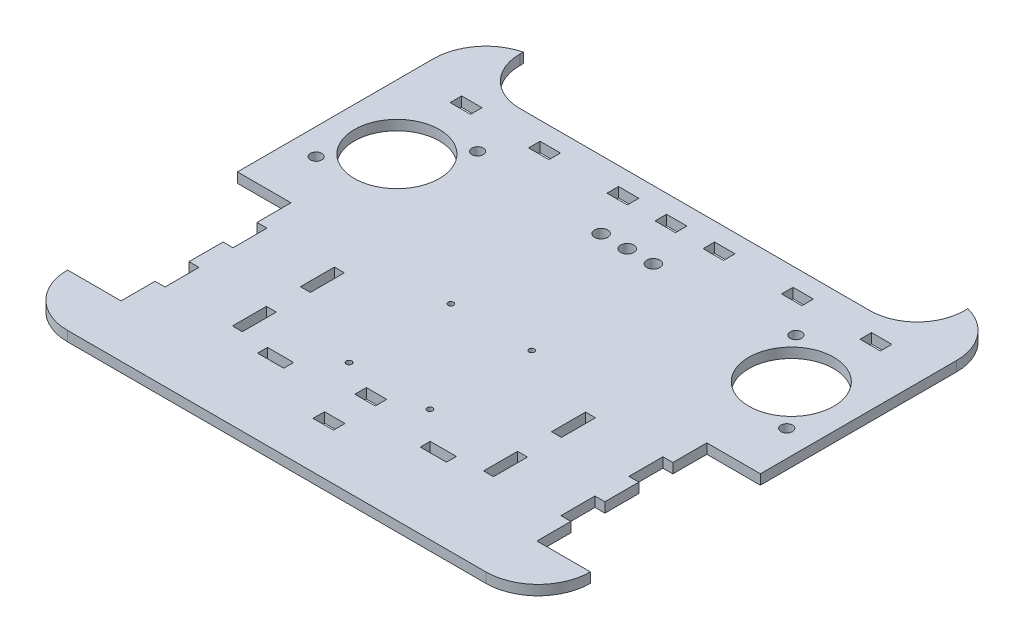
from build123d import *

# Parameters (mm, degrees)
SKETCH1_W           = 254
SKETCH1_H           = 228.6
BOSS_EXTRUDE1_DEPTH = 4.826
SKETCH2_W           = 26.00000007
SKETCH2_H           = 82.55
CUT_EXTRUDE1_DEPTH  = 4.826
CUT_EXTRUDE3_DEPTH  = 4.826
SKETCH7_W           = 215.9
SKETCH7_H           = 25.4
CUT_EXTRUDE5_DEPTH  = 4.826
FILLET9_R           = 22.86
FILLET10_R          = 22.86
CUT_EXTRUDE6_DEPTH  = 4.826
SKETCH10_W          = 4.826
SKETCH10_H          = 16.51
CUT_EXTRUDE8_DEPTH  = 171.929167423
SKETCH12_W          = 4.826
SKETCH12_H          = 16.51
CUT_EXTRUDE9_DEPTH  = 171.929167423
SKETCH13_W          = 4.826
SKETCH13_H          = 16.51
CUT_EXTRUDE10_DEPTH = 171.929167423
SKETCH15_R          = 1.3462
CUT_EXTRUDE11_DEPTH = 171.929167423
SKETCH16_R          = 2.778125
SKETCH16_R_2        = 20.6375
CUT_EXTRUDE12_DEPTH = 171.929167423
SKETCH17_W          = 9.906
SKETCH17_H          = 5.588
CUT_EXTRUDE13_DEPTH = 171.929167423
SKETCH18_W          = 9.906
SKETCH18_H          = 5.588
CUT_EXTRUDE14_DEPTH = 171.929167423
SKETCH19_R          = 3.175
CUT_EXTRUDE15_DEPTH = 171.929167423
SKETCH22_W          = 12.7
SKETCH22_H          = 4.826
CUT_EXTRUDE18_DEPTH = 171.929167423


with BuildPart() as part:
    # Sketch1 → Boss-Extrude1 (new body)
    with BuildSketch(Plane(origin=(0, 0, 0), x_dir=(1, 0, 0), z_dir=(0, 1, 0))):
        Rectangle(SKETCH1_W, SKETCH1_H)
    extrude(amount=BOSS_EXTRUDE1_DEPTH)

    # Sketch2 → Cut-Extrude1 (cut)
    with BuildSketch(Plane(origin=(0, 4.826, 0), x_dir=(1, 0, 0), z_dir=(0, 1, 0))):
        with Locations((-113.999999965, -47.625)):
            Rectangle(SKETCH2_W, SKETCH2_H)
        with Locations((113.999999965, -47.625)):
            Rectangle(SKETCH2_W, SKETCH2_H)
    extrude(amount=-CUT_EXTRUDE1_DEPTH, mode=Mode.SUBTRACT)

    # Sketch4 → Cut-Extrude3 (cut)
    with BuildSketch(Plane(origin=(0, 4.826, 0), x_dir=(1, 0, 0), z_dir=(0, 1, 0))):
        with BuildLine():
            Line((-127, 88.9), (-127, 114.3))
            Line((-127, 114.3), (-101.6, 114.3))
            ThreePointArc((-101.6, 114.3), (-119.560512242, 106.860512242), (-127, 88.9))
        make_face()
        with BuildLine():
            Line((127, 88.9), (127, 114.3))
            Line((127, 114.3), (101.6, 114.3))
            ThreePointArc((101.6, 114.3), (119.560512242, 106.860512242), (127, 88.9))
        make_face()
    extrude(amount=-CUT_EXTRUDE3_DEPTH, mode=Mode.SUBTRACT)

    # Sketch7 → Cut-Extrude5 (cut)
    with BuildSketch(Plane(origin=(0, 4.826, 0), x_dir=(1, 0, 0), z_dir=(0, 1, 0))):
        with Locations((0, 101.6)):
            Rectangle(SKETCH7_W, SKETCH7_H)
    extrude(amount=-CUT_EXTRUDE5_DEPTH, mode=Mode.SUBTRACT)

    # Fillet9
    fillet9_edges = [part.edges().sort_by_distance(p)[0] for p in [
        (-107.95, 2.413, -88.9),
    ]]
    fillet(fillet9_edges, radius=FILLET9_R)

    # Fillet10
    fillet10_edges = [part.edges().sort_by_distance(p)[0] for p in [
        (107.95, 2.413, -88.9),
    ]]
    fillet(fillet10_edges, radius=FILLET10_R)

    # Sketch8 → Cut-Extrude6 (cut)
    with BuildSketch(Plane(origin=(0, 4.826, 0), x_dir=(1, 0, 0), z_dir=(0, 1, 0))):
        with BuildLine():
            Line((-127, -88.9), (-127, -114.3))
            Line((-127, -114.3), (-101.6, -114.3))
            ThreePointArc((-101.6, -114.3), (-119.560512242, -106.860512242), (-127, -88.9))
        make_face()
        with BuildLine():
            Line((127, -114.3), (101.6, -114.3))
            ThreePointArc((101.6, -114.3), (119.560512242, -106.860512242), (127, -88.9))
            Line((127, -88.9), (127, -114.3))
        make_face()
    extrude(amount=-CUT_EXTRUDE6_DEPTH, mode=Mode.SUBTRACT)

    # Sketch10 → Cut-Extrude8 (cut, through all)
    with BuildSketch(Plane(origin=(0, 4.826, 0), x_dir=(1, 0, 0), z_dir=(0, 1, 0))):
        with Locations((-98.58699993, -64.135)):
            Rectangle(SKETCH10_W, SKETCH10_H)
        with Locations((-98.58699993, -31.115)):
            Rectangle(SKETCH10_W, SKETCH10_H)
        with Locations((98.58699993, -31.115)):
            Rectangle(SKETCH10_W, SKETCH10_H)
        with Locations((98.58699993, -64.135)):
            Rectangle(SKETCH10_W, SKETCH10_H)
    extrude(amount=-CUT_EXTRUDE8_DEPTH, mode=Mode.SUBTRACT)

    # Sketch12 → Cut-Extrude9 (cut, through all)
    with BuildSketch(Plane.XZ):
        with Locations((-60.99499993, 64.135)):
            Rectangle(SKETCH12_W, SKETCH12_H)
        with Locations((-60.99499993, 31.115)):
            Rectangle(SKETCH12_W, SKETCH12_H)
    extrude(amount=-CUT_EXTRUDE9_DEPTH, mode=Mode.SUBTRACT)

    # Sketch13 → Cut-Extrude10 (cut, through all)
    with BuildSketch(Plane(origin=(0, 4.826, 0), x_dir=(1, 0, 0), z_dir=(0, 1, 0))):
        with Locations((60.99499993, -64.135)):
            Rectangle(SKETCH13_W, SKETCH13_H)
        with Locations((60.99499993, -31.115)):
            Rectangle(SKETCH13_W, SKETCH13_H)
    extrude(amount=-CUT_EXTRUDE10_DEPTH, mode=Mode.SUBTRACT)

    # Sketch15 → Cut-Extrude11 (cut, through all)
    with BuildSketch(Plane(origin=(0, 4.826, 0), x_dir=(1, 0, 0), z_dir=(0, 1, 0))):
        with Locations((19.5961, -10.030838906)):
            Circle(SKETCH15_R)
        with Locations((-19.6723, -10.030838906)):
            Circle(SKETCH15_R)
        with Locations((-19.6723, -59.463561094)):
            Circle(SKETCH15_R)
        with Locations((19.5961, -59.463561094)):
            Circle(SKETCH15_R)
    extrude(amount=-CUT_EXTRUDE11_DEPTH, mode=Mode.SUBTRACT)

    # Sketch16 → Cut-Extrude12 (cut, through all)
    with BuildSketch(Plane(origin=(0, 4.826, 0), x_dir=(1, 0, 0), z_dir=(0, 1, 0))):
        with Locations((77.293854564, 60.610218612)):
            Circle(SKETCH16_R)
        with Locations((114.3, 19.164632523)):
            Circle(SKETCH16_R)
        with Locations((95.796927282, 39.887425568)):
            Circle(SKETCH16_R_2)
        with Locations((-95.796927282, 39.887425568)):
            Circle(SKETCH16_R_2)
        with Locations((-77.293854564, 60.610218612)):
            Circle(SKETCH16_R)
        with Locations((-114.3, 19.164632523)):
            Circle(SKETCH16_R)
    extrude(amount=-CUT_EXTRUDE12_DEPTH, mode=Mode.SUBTRACT)

    # Sketch17 → Cut-Extrude13 (cut, through all)
    with BuildSketch(Plane(origin=(0, 4.826, 0), x_dir=(1, 0, 0), z_dir=(0, 1, 0))):
        with Locations((-61.445869789, 77.244822677)):
            Rectangle(SKETCH17_W, SKETCH17_H)
        with Locations((-99.545869789, 77.244822677)):
            Rectangle(SKETCH17_W, SKETCH17_H)
        with Locations((-23.345869789, 77.244822677)):
            Rectangle(SKETCH17_W, SKETCH17_H)
        with Locations((0, 77.244822677)):
            Rectangle(SKETCH17_W, SKETCH17_H)
        with Locations((23.345869789, 77.244822677)):
            Rectangle(SKETCH17_W, SKETCH17_H)
        with Locations((61.445869789, 77.244822677)):
            Rectangle(SKETCH17_W, SKETCH17_H)
        with Locations((99.545869789, 77.244822677)):
            Rectangle(SKETCH17_W, SKETCH17_H)
    extrude(amount=-CUT_EXTRUDE13_DEPTH, mode=Mode.SUBTRACT)

    # Sketch18 → Cut-Extrude14 (cut, through all)
    with BuildSketch(Plane(origin=(0, 4.826, 0), x_dir=(1, 0, 0), z_dir=(0, 1, 0))):
        with Locations((0, -88.9)):
            Rectangle(SKETCH18_W, SKETCH18_H)
        with Locations((0, -68.58)):
            Rectangle(SKETCH18_W, SKETCH18_H)
    extrude(amount=-CUT_EXTRUDE14_DEPTH, mode=Mode.SUBTRACT)

    # Sketch19 → Cut-Extrude15 (cut, through all)
    with BuildSketch(Plane(origin=(0, 4.826, 0), x_dir=(1, 0, 0), z_dir=(0, 1, 0))):
        with Locations((0, 55.982011538)):
            Circle(SKETCH19_R)
        with Locations((12.7, 55.982011538)):
            Circle(SKETCH19_R)
        with Locations((-12.7, 55.982011538)):
            Circle(SKETCH19_R)
    extrude(amount=-CUT_EXTRUDE15_DEPTH, mode=Mode.SUBTRACT)

    # Sketch22 → Cut-Extrude18 (cut, through all)
    with BuildSketch(Plane.XZ):
        with Locations((-39.53199993, 75.311)):
            Rectangle(SKETCH22_W, SKETCH22_H)
        with Locations((39.53199993, 75.311)):
            Rectangle(SKETCH22_W, SKETCH22_H)
    extrude(amount=-CUT_EXTRUDE18_DEPTH, mode=Mode.SUBTRACT)


solid = part.part
